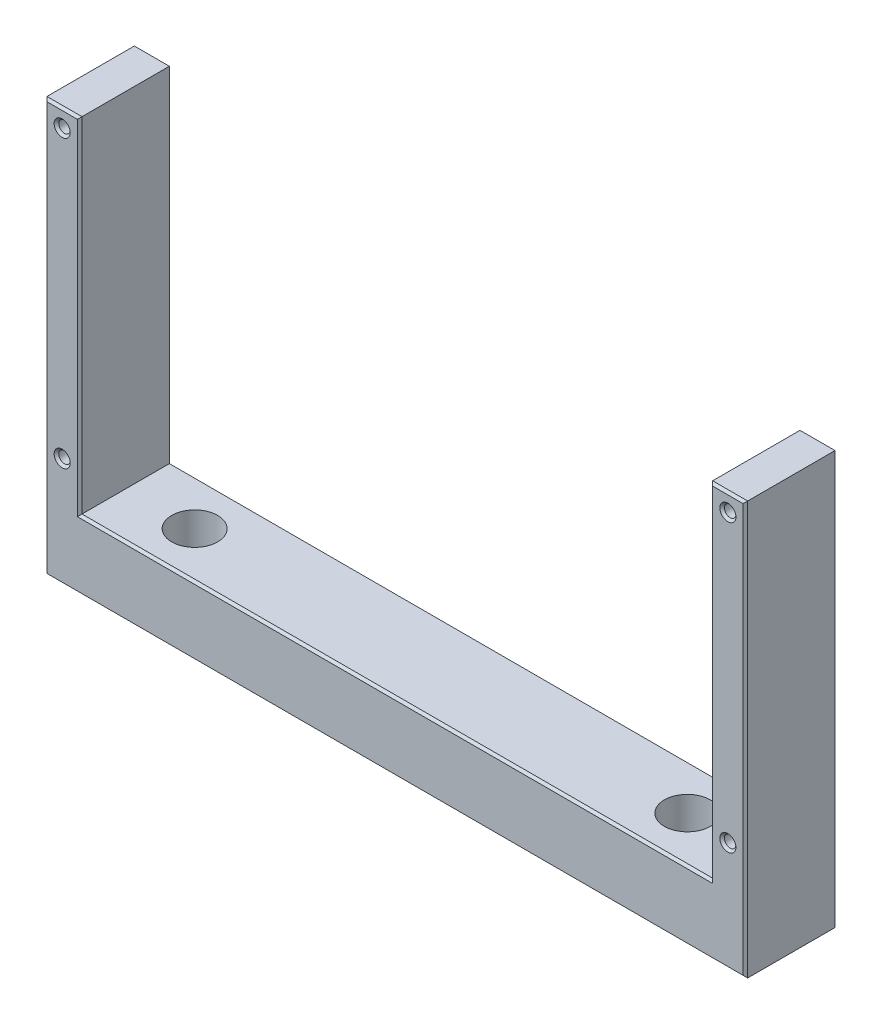
from build123d import *

# Parameters (mm, degrees)
BOSS_EXTRUDE1_DEPTH            = 20
M3X0_5_TAPPED_HOLE1_D          = 2.5
CHAMFER1_SIZE                  = 0.5
CBORE_FOR_M5_SHCS1_D           = 5.5
CBORE_FOR_M5_SHCS1_CBORE_D     = 10
CBORE_FOR_M5_SHCS1_CBORE_DEPTH = 10


with BuildPart() as part:
    # Sketch2 → Boss-Extrude1 (new body)
    with BuildSketch(Plane.XY):
        Polygon((-76.2, 34.925), (-68.58, 34.925), (-68.58, -39.925), (68.58, -39.925), (68.58, 34.925), (76.2, 34.925), (76.2, -54.925), (-76.2, -54.925), align=None)
    extrude(amount=BOSS_EXTRUDE1_DEPTH)

    # M3x0.5 Tapped Hole1 (through all)
    with Locations(Plane(origin=(0, 0, 0), x_dir=(-1, 0, 0), z_dir=(0, 0, -1))):
        with Locations((-72.39, -31.115), (-72.39, 31.115), (72.39, 31.115), (72.39, -31.115)):
            Hole(M3X0_5_TAPPED_HOLE1_D / 2)

    # Chamfer1
    chamfer1_edges = [part.edges().sort_by_distance(p)[0] for p in [
        (0, -54.925, 0),
        (68.58, -2.5, 0),
        (0, -39.925, 0),
        (-68.58, -2.5, 0),
        (-72.39, 34.925, 0),
        (-76.2, -10, 0),
        (-73.64, -31.115, 0),
        (-73.64, 31.115, 0),
        (71.14, 31.115, 0),
        (71.14, -31.115, 0),
        (-72.39, 34.925, 20),
        (-68.58, -2.5, 20),
        (0, -39.925, 20),
        (72.39, 34.925, 20),
        (0, -54.925, 20),
        (-76.2, -10, 20),
        (-73.64, -31.115, 20),
        (-73.64, 31.115, 20),
        (71.14, 31.115, 20),
        (71.14, -31.115, 20),
        (68.58, -2.5, 20),
        (72.39, 34.925, 0),
        (76.2, -10, 20),
        (76.2, -10, 0),
    ]]
    chamfer(chamfer1_edges, length=CHAMFER1_SIZE)

    # CBORE for M5 SHCS1 (through all)
    with Locations(Plane(origin=(-53.58, -39.925, 10), x_dir=(1, 0, 0), z_dir=(0, 1, 0))):
        with Locations((0, 0), (107.16, 0)):
            CounterBoreHole(CBORE_FOR_M5_SHCS1_D / 2, CBORE_FOR_M5_SHCS1_CBORE_D / 2, CBORE_FOR_M5_SHCS1_CBORE_DEPTH)


solid = part.part
